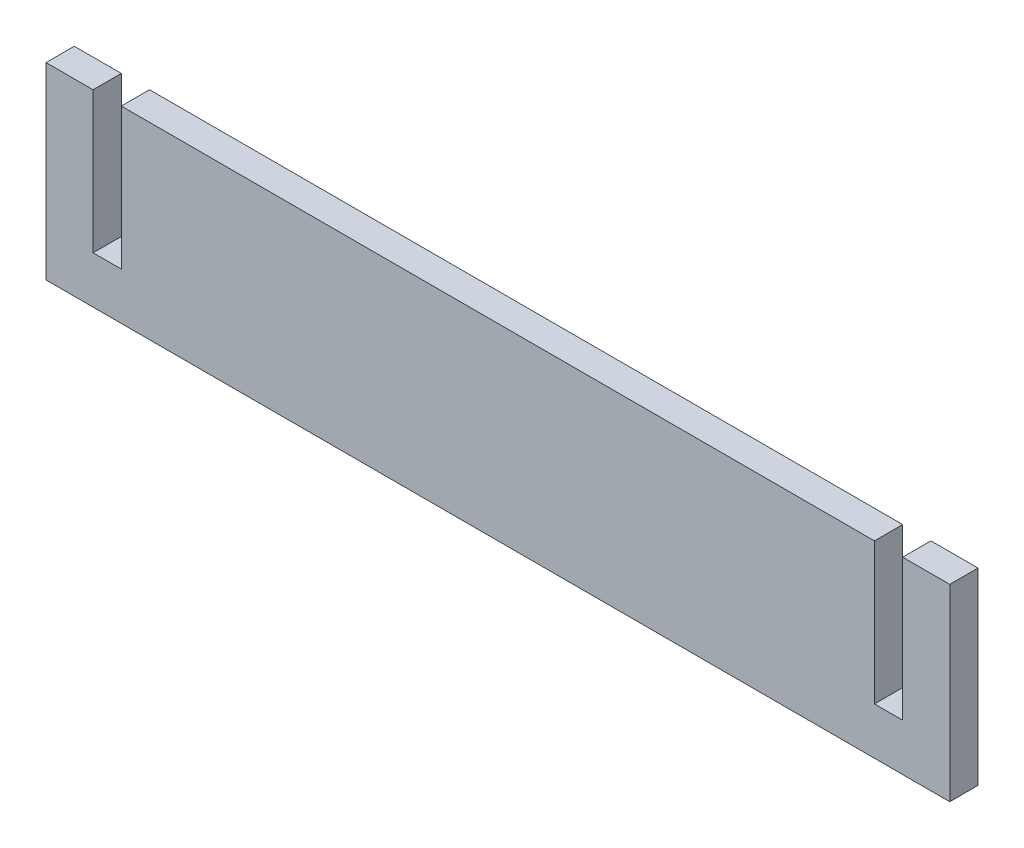
from build123d import *

# Parameters (mm, degrees)
BOSS_EXTRUDE1_DEPTH = 3


with BuildPart() as part:
    # Sketch1 → Boss-Extrude1 (new body)
    with BuildSketch(Plane.XY):
        Polygon((-43, 10), (-43, -5), (-40, -5), (-40, 10), (40, 10), (40, -5), (43, -5), (43, 10), (48, 10), (48, -10), (-48, -10), (-48, 10), align=None)
    extrude(amount=BOSS_EXTRUDE1_DEPTH)


solid = part.part
